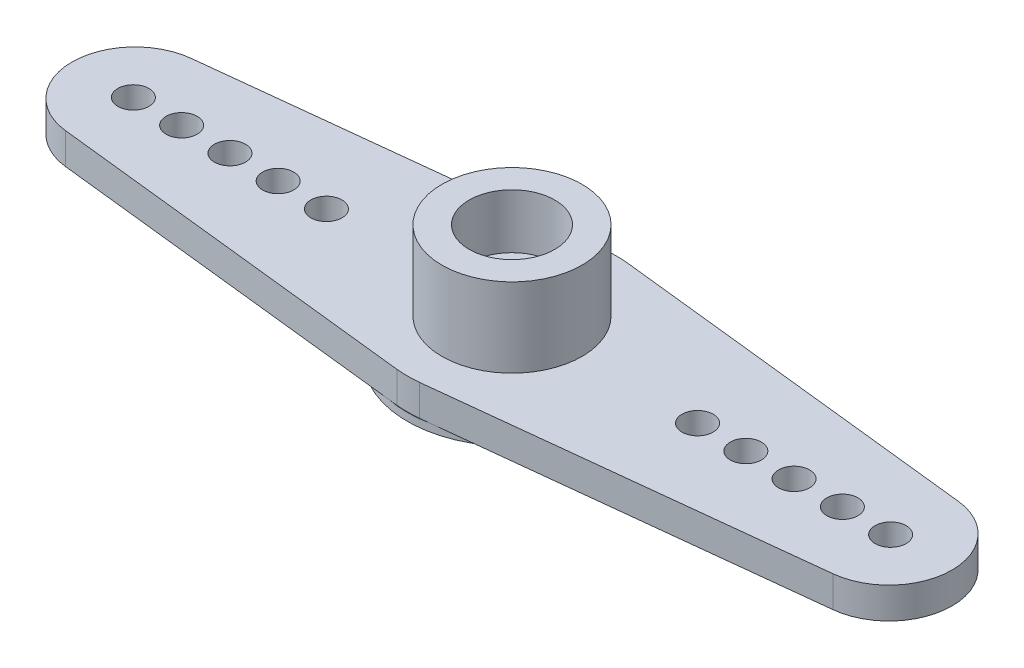
from build123d import *
from build123d.topology import SkipClean

# Parameters (mm, degrees)
BOSS_EXTRUDE1_DEPTH = 2
SKETCH2_R           = 1.000000794
CUT_EXTRUDE1_DEPTH  = 2
SKETCH3_R           = 4.5
BOSS_EXTRUDE2_DEPTH = 5.08
SKETCH4_R           = 2.75
CUT_EXTRUDE2_DEPTH  = 3.5
SKETCH5_R           = 3.25
CUT_EXTRUDE3_DEPTH  = 3.25
SKETCH7_R           = 6.724332425
BOSS_EXTRUDE3_DEPTH = 0.5
SKETCH8_W           = 14.5
SKETCH8_H           = 1.25
SKETCH8_H_2         = 1.25000004
BOSS_EXTRUDE4_DEPTH = 0.5
SKETCH6_R           = 2
CUT_EXTRUDE4_DEPTH  = 30.338041851
SKETCH15_R          = 3.25
CUT_EXTRUDE5_DEPTH  = 3.75


# Read off the part's stored shape, not the designer's step: Mirror3
with BuildPart() as part:
    # Sketch1 → Boss-Extrude1 (new body)
    with BuildSketch(Plane(origin=(0, 0, 0), x_dir=(1, 0, 0), z_dir=(0, 1, 0))):
        with BuildLine():
            Line((-24.656541995, 4.026414392), (-0.733072501, 6.659779954))
            ThreePointArc((-0.733072501, 6.659779954), (0, 6.695526614), (0.733072501, 6.659779954))
            Line((0.733072501, 6.659779954), (24.656541995, 4.026414392))
            ThreePointArc((24.656541995, 4.026414392), (28.264069964, 0), (24.656541995, -4.026414392))
            Line((24.656541995, -4.026414392), (0.733072501, -6.659779954))
            ThreePointArc((0.733072501, -6.659779954), (0, -6.695526614), (-0.733072501, -6.659779954))
            Line((-0.733072501, -6.659779954), (-24.656541995, -4.026414392))
            ThreePointArc((-24.656541995, -4.026414392), (-28.264069964, 0), (-24.656541995, 4.026414392))
        make_face()
    extrude(amount=BOSS_EXTRUDE1_DEPTH)

    # Sketch2 → Cut-Extrude1 (cut)
    with BuildSketch(Plane(origin=(0, 2, 0), x_dir=(1, 0, 0), z_dir=(0, 1, 0))):
        with Locations(Location((-24.320001144, 0, 0), (0, 0, 270))):
            Circle(SKETCH2_R)
        with Locations(Location((-21.222128244, 0, 0), (0, 0, 270))):
            Circle(SKETCH2_R)
        with Locations(Location((-18.117543648, 0, 0), (0, 0, 270))):
            Circle(SKETCH2_R)
        with Locations(Location((-15.019999932, 0, 0), (0, 0, 270))):
            Circle(SKETCH2_R)
        with Locations(Location((-11.919999782, 0, 0), (0, 0, 270))):
            Circle(SKETCH2_R)
        with Locations(Location((24.320001144, 0, 0), (0, 0, 90))):
            Circle(SKETCH2_R)
        with Locations(Location((21.222128244, 0, 0), (0, 0, 90))):
            Circle(SKETCH2_R)
        with Locations(Location((18.117543648, 0, 0), (0, 0, 90))):
            Circle(SKETCH2_R)
        with Locations(Location((15.019999932, 0, 0), (0, 0, 90))):
            Circle(SKETCH2_R)
        with Locations(Location((11.919999782, 0, 0), (0, 0, 90))):
            Circle(SKETCH2_R)
    extrude(amount=-CUT_EXTRUDE1_DEPTH, mode=Mode.SUBTRACT)

    # Sketch3 → Boss-Extrude2 (add)
    with BuildSketch(Plane(origin=(0, 2, 0), x_dir=(1, 0, 0), z_dir=(0, 1, 0))):
        with Locations(Location((0, 0, 0), (0, 0, 270))):
            Circle(SKETCH3_R)
    extrude(amount=BOSS_EXTRUDE2_DEPTH)

    # Sketch4 → Cut-Extrude2 (cut)
    with BuildSketch(Plane(origin=(0, 7.08, 0), x_dir=(1, 0, 0), z_dir=(0, 1, 0))):
        with Locations(Location((0, 0, 0), (0, 0, 270))):
            Circle(SKETCH4_R)
    extrude(amount=-CUT_EXTRUDE2_DEPTH, mode=Mode.SUBTRACT)

    # Sketch5 → Cut-Extrude3 (cut)
    with BuildSketch(Plane.XZ):
        with Locations(Location((0, 0, 0), (0, 0, 270))):
            Circle(SKETCH5_R)
    extrude(amount=-CUT_EXTRUDE3_DEPTH, mode=Mode.SUBTRACT)

    # Sketch7 → Boss-Extrude3 (add)
    with BuildSketch(Plane.XZ):
        with Locations(Location((0, 0, 0), (0, 0, 78.843263662))):
            Circle(SKETCH7_R)
    extrude(amount=BOSS_EXTRUDE3_DEPTH)

    # Sketch8 → Boss-Extrude4 (add)
    with BuildSketch(Plane.XZ):
        Rectangle(SKETCH8_W, SKETCH8_H)
        with Locations((0, -4.843845819)):
            Rectangle(SKETCH8_W, SKETCH8_H_2)
        with Locations((0, 4.843845819)):
            Rectangle(SKETCH8_W, SKETCH8_H_2)
    extrude(amount=BOSS_EXTRUDE4_DEPTH)

    # Sketch13 → Cut-Loft1 section 0
    with BuildSketch(Plane.XY.offset(-4.218845799)):
        with BuildLine():
            Line((-7.25, 0), (-5.236218739, -0.5))
            Line((-5.236218739, -0.5), (-7.25, -0.5))
            Line((-7.25, -0.5), (-7.25, 0))
        make_face()
    # Sketch12 → Cut-Loft1 section 1
    with BuildSketch(Plane(origin=(0, 0, -5.468845839), x_dir=(-1, 0, 0), z_dir=(0, 0, -1))):
        with BuildLine():
            Line((3.912591436, -0.5), (7.25, -0.5))
            Line((7.25, -0.5), (7.25, 0))
            Line((7.25, 0), (3.912591436, -0.5))
        make_face()
    cut_loft1 = loft(mode=Mode.SUBTRACT)

    # Mirror1: Cut-Loft1 across plane
    add(cut_loft1.mirror(Plane.XY), mode=Mode.SUBTRACT)

    # Mirror2: Cut-Loft1 across plane
    add(cut_loft1.mirror(Plane(origin=(0, 0, 0), x_dir=(0, 0, 1), z_dir=(1, 0, 0))), mode=Mode.SUBTRACT)

    # Mirror3
    split(bisect_by=Plane.XY, keep=Keep.BOTTOM)

    # Mirror3 2: part across plane


with BuildPart() as part_1:
    with SkipClean():  # the faces are left unmerged after this step: merging them gives an invalid solid
        add(part.part)
        add(part.part.mirror(Plane.XY))

    # Sketch10 → Cut-Loft2 section 0
    with SkipClean():  # the faces are left unmerged after this step: merging them gives an invalid solid
        with BuildSketch(Plane(origin=(0, 0, -0.625), x_dir=(-1, 0, 0), z_dir=(0, 0, -1))):
            with BuildLine():
                Line((7.25, -0.5), (6.695223787, -0.5))
                Line((6.695223787, -0.5), (7.25, 0))
                Line((7.25, 0), (7.25, -0.5))
            make_face()
        # Sketch14 → Cut-Loft2 section 1
        with BuildSketch(Plane.XY.offset(0.625)):
            with BuildLine():
                Line((-7.25, 0), (-6.695223787, -0.5))
                Line((-6.695223787, -0.5), (-7.25, -0.5))
                Line((-7.25, -0.5), (-7.25, 0))
            make_face()
        cut_loft2 = loft(mode=Mode.SUBTRACT)

    # Mirror5: Cut-Loft2 across plane
    with SkipClean():  # the faces are left unmerged after this step: merging them gives an invalid solid
        add(cut_loft2.mirror(Plane(origin=(0, 0, 0), x_dir=(0, 0, 1), z_dir=(1, 0, 0))), mode=Mode.SUBTRACT)

    # Sketch6 → Cut-Extrude4 (cut, through all)
    with SkipClean():  # the faces are left unmerged after this step: merging them gives an invalid solid
        with BuildSketch(Plane(origin=(0, 3.58, 0), x_dir=(1, 0, 0), z_dir=(0, 1, 0))):
            with Locations(Location((0, 0, 0), (0, 0, 270))):
                Circle(SKETCH6_R)
        extrude(amount=-CUT_EXTRUDE4_DEPTH, mode=Mode.SUBTRACT)

    # Sketch15 → Cut-Extrude5 (cut)
    with SkipClean():  # the faces are left unmerged after this step: merging them gives an invalid solid
        with BuildSketch(Plane.XZ.offset(0.5)):
            with Locations(Location((0, 0, 0), (0, 0, 270))):
                Circle(SKETCH15_R)
        extrude(amount=-CUT_EXTRUDE5_DEPTH, mode=Mode.SUBTRACT)


solid = part_1.part
